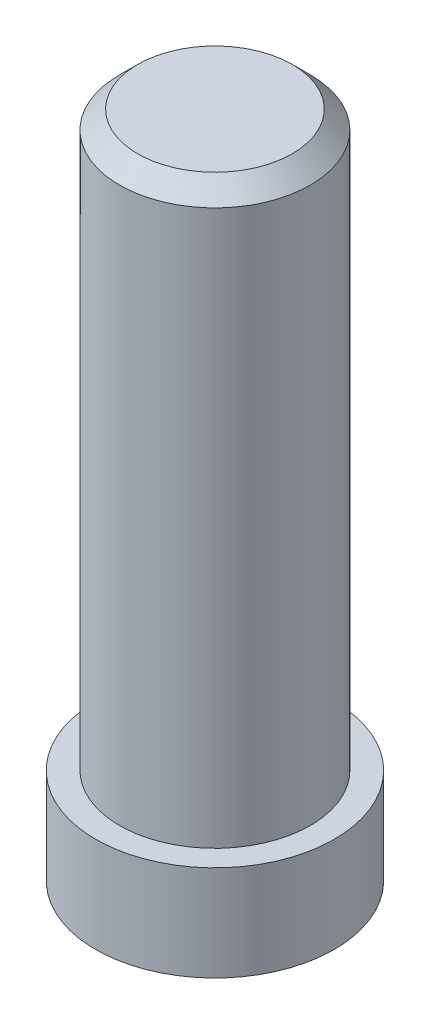
from build123d import *

# Parameters (mm, degrees)
SKETCH_1_R      = 2
EXTRUDE_1_DEPTH = 6.5
EXTRUDE_START   = 1
SKETCH_2_R      = 2.5
EXTRUDE_2_DEPTH = 2


# Read off the part's stored shape, not the designer's step: M4 机械螺纹 螺柱1
with BuildPart() as part:
    # 草图1 → 凸台-拉伸1 (new, symmetric)
    with BuildSketch(Plane(origin=(0, 0, 0), x_dir=(1, 0, 0), z_dir=(0, 1, 0))):
        with Locations(Location((0, 0, 0), (0, 0, 90))):
            Circle(SKETCH_1_R)
    extrude(amount=EXTRUDE_1_DEPTH, both=True)

    # 草图2 → 凸台-拉伸2 (add)
    with BuildSketch(Plane.XZ.offset(6.5).offset(EXTRUDE_START)):
        with Locations(Location((0, 0, 0), (0, 0, 270))):
            Circle(SKETCH_2_R)
    extrude(amount=-EXTRUDE_2_DEPTH)

    # M4 机械螺纹 螺柱1 outline → M4 机械螺纹 螺柱1 (revolve, cut)
    with BuildSketch(Plane.XY):
        Polygon((2, 6.5), (1.621, 6.5), (2, 6.121), align=None)
    revolve(axis=Axis((0, 0, 0), (0, 1, 0)), mode=Mode.SUBTRACT)


solid = part.part
